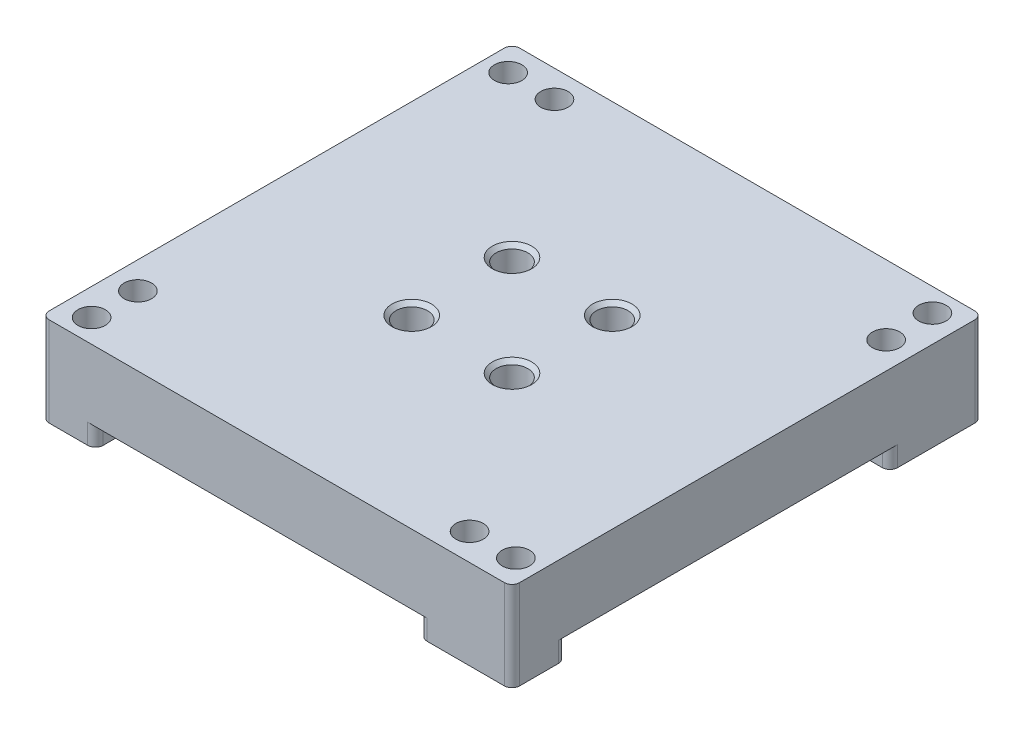
from build123d import *

# Parameters (mm, degrees)
BOSS_EXTRUDE1_DEPTH = 9
SKETCH2_W           = 7
SKETCH2_H           = 12
SKETCH2_R           = 1.775
SKETCH2_W_2         = 12
SKETCH2_H_2         = 7
BOSS_EXTRUDE2_DEPTH = 11.6
SKETCH7_R           = 1.775
CUT_EXTRUDE1_DEPTH  = 45.666094524
FILLET1_R           = 1
SKETCH17_R          = 2.05
CUT_EXTRUDE9_DEPTH  = 6.5
CHAMFER1_SIZE       = 0.5


with BuildPart() as part:
    # Sketch1 → Boss-Extrude1 (new body)
    with BuildSketch(Plane(origin=(0, 0, 0), x_dir=(1, 0, 0), z_dir=(0, 1, 0))):
        with BuildLine():
            Line((28.5, -30.5), (-28.5, -30.5))
            ThreePointArc((-28.5, -30.5), (-29.914213562, -29.914213562), (-30.5, -28.5))
            Line((-30.5, -28.5), (-30.5, 28.5))
            ThreePointArc((-30.5, 28.5), (-29.914213562, 29.914213562), (-28.5, 30.5))
            Line((-28.5, 30.5), (28.5, 30.5))
            ThreePointArc((28.5, 30.5), (29.914213562, 29.914213562), (30.5, 28.5))
            Line((30.5, 28.5), (30.5, -28.5))
            ThreePointArc((30.5, -28.5), (29.914213562, -29.914213562), (28.5, -30.5))
        make_face()
    extrude(amount=BOSS_EXTRUDE1_DEPTH)

    # Sketch2 → Boss-Extrude2 (add)
    # profile 1 of 4: a face of its own
    with BuildSketch(Plane(origin=(0, 9, 0), x_dir=(1, 0, 0), z_dir=(0, 1, 0))):
        with Locations((-27, -24.5)):
            Rectangle(SKETCH2_W, SKETCH2_H)
        with Locations((-27, -21.5)):
            Circle(SKETCH2_R, mode=Mode.SUBTRACT)
        with Locations((-27, -27.5)):
            Circle(SKETCH2_R, mode=Mode.SUBTRACT)
    # profile 2 of 4: a face of its own
    with BuildSketch(Plane(origin=(0, 9, 0), x_dir=(1, 0, 0), z_dir=(0, 1, 0))):
        with Locations((24.5, -27)):
            Rectangle(SKETCH2_W_2, SKETCH2_H_2)
        with Locations((21.5, -27)):
            Circle(SKETCH2_R, mode=Mode.SUBTRACT)
        with Locations((27.5, -27)):
            Circle(SKETCH2_R, mode=Mode.SUBTRACT)
    # profile 3 of 4: a face of its own
    with BuildSketch(Plane(origin=(0, 9, 0), x_dir=(1, 0, 0), z_dir=(0, 1, 0))):
        with Locations((27, 24.5)):
            Rectangle(SKETCH2_W, SKETCH2_H)
        with Locations((27, 21.5)):
            Circle(SKETCH2_R, mode=Mode.SUBTRACT)
        with Locations((27, 27.5)):
            Circle(SKETCH2_R, mode=Mode.SUBTRACT)
    # profile 4 of 4: a face of its own
    with BuildSketch(Plane(origin=(0, 9, 0), x_dir=(1, 0, 0), z_dir=(0, 1, 0))):
        with Locations((-24.5, 27)):
            Rectangle(SKETCH2_W_2, SKETCH2_H_2)
        with Locations((-21.5, 27)):
            Circle(SKETCH2_R, mode=Mode.SUBTRACT)
        with Locations((-27.5, 27)):
            Circle(SKETCH2_R, mode=Mode.SUBTRACT)
    extrude(amount=-BOSS_EXTRUDE2_DEPTH)

    # Sketch7 → Cut-Extrude1 (cut, through all)
    with BuildSketch(Plane(origin=(0, 9, 0), x_dir=(1, 0, 0), z_dir=(0, 1, 0))):
        with Locations((27.5, -27)):
            Circle(SKETCH7_R)
        with Locations((21.5, -27)):
            Circle(SKETCH7_R)
        with Locations((-27, -27.5)):
            Circle(SKETCH7_R)
        with Locations((-27, -21.5)):
            Circle(SKETCH7_R)
        with Locations((27, 21.5)):
            Circle(SKETCH7_R)
        with Locations((27, 27.5)):
            Circle(SKETCH7_R)
        with Locations((-21.5, 27)):
            Circle(SKETCH7_R)
        with Locations((-27.5, 27)):
            Circle(SKETCH7_R)
    extrude(amount=-CUT_EXTRUDE1_DEPTH, mode=Mode.SUBTRACT)

    # Fillet1
    fillet1_edges = [part.edges().sort_by_distance(p)[0] for p in [
        (-30.5, -1.3, 18.5),
        (30.5, -1.3, 23.5),
        (18.5, -1.3, 23.5),
        (30.5, 3.2, 30.5),
        (18.5, -1.3, 30.5),
        (-23.5, -1.3, 18.5),
        (-30.5, 3.2, 30.5),
        (-23.5, -1.3, 30.5),
        (30.5, 3.2, -30.5),
        (23.5, -1.3, -30.5),
        (23.5, -1.3, -18.5),
        (30.5, -1.3, -18.5),
        (-18.5, -1.3, -30.5),
        (-30.5, -1.3, -23.5),
        (-18.5, -1.3, -23.5),
        (-30.5, 3.2, -30.5),
    ]]
    fillet(fillet1_edges, radius=FILLET1_R)

    # Sketch17 → Cut-Extrude9 (cut)
    with BuildSketch(Plane(origin=(0, 9, 0), x_dir=(1, 0, 0), z_dir=(0, 1, 0))):
        with Locations((-6.5, 6.5)):
            Circle(SKETCH17_R)
        with Locations((6.5, 6.5)):
            Circle(SKETCH17_R)
        with Locations((-6.5, -6.5)):
            Circle(SKETCH17_R)
        with Locations((6.5, -6.5)):
            Circle(SKETCH17_R)
    extrude(amount=-CUT_EXTRUDE9_DEPTH, mode=Mode.SUBTRACT)

    # Chamfer1
    chamfer1_edges = [part.edges().sort_by_distance(p)[0] for p in [
        (4.45, 9, 6.5),
        (-8.55, 9, 6.5),
        (4.45, 9, -6.5),
        (-8.55, 9, -6.5),
    ]]
    chamfer(chamfer1_edges, length=CHAMFER1_SIZE)


solid = part.part
